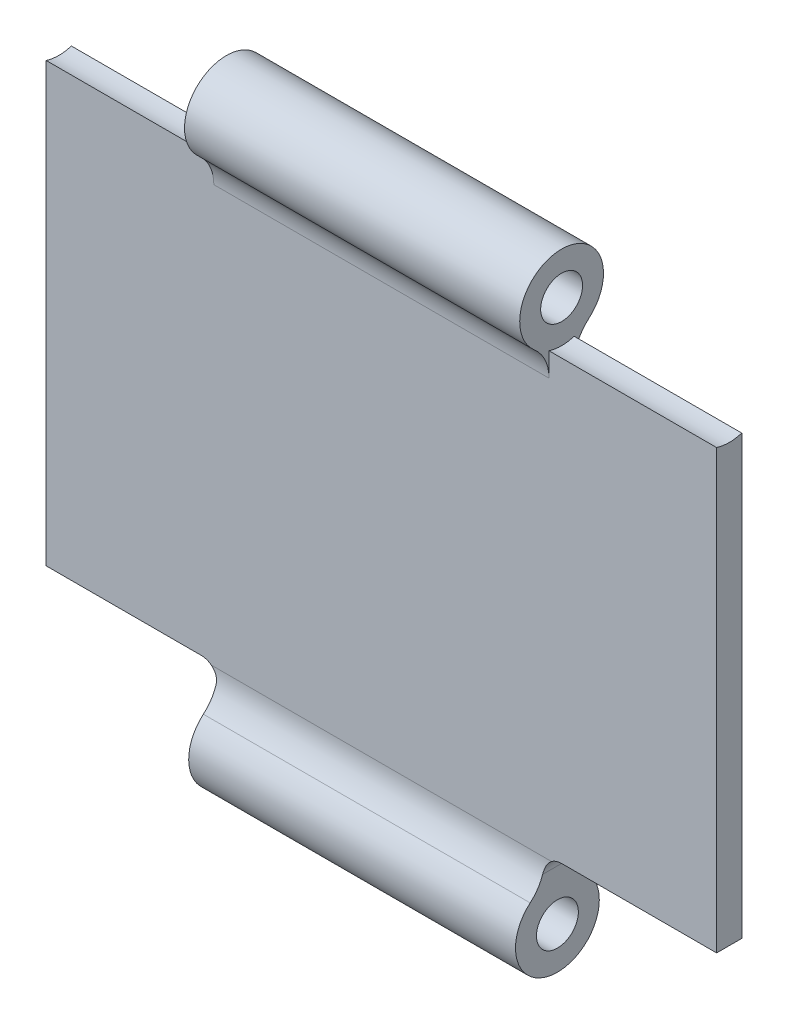
from build123d import *

# Parameters (mm, degrees)
SKETCH_1_W                  = 80
SKETCH_1_H                  = 65
EXTRUDE_1_DEPTH             = 3
CUT_EXTRUDE_1_DEPTH         = 52.626059311
CUT_EXTRUDE_1_DEPTH_BACK    = 3
EXTRUDE_2_REACH             = 53.626
SKETCH_4_R                  = 5
EXTRUDE_2_DIRECTION_2_REACH = 53.626
SKETCH_6_R                  = 2.5
CUT_EXTRUDE_3_DEPTH         = 71.631083809
FILLET_1_R                  = 5
SKETCH_8_R                  = 5
EXTRUDE_3_DEPTH             = 20
SKETCH_9_R                  = 5
CUT_EXTRUDE_4_DEPTH         = 72.052797271
FILLET_2_R                  = 5
SKETCH_10_R                 = 2.5
CUT_EXTRUDE_5_DEPTH         = 72.052797271
FILLET_3_R                  = 2


with BuildPart() as part:
    # 草图1 → 凸台-拉伸1 (new body)
    with BuildSketch(Plane.XY):
        Rectangle(SKETCH_1_W, SKETCH_1_H)
    extrude(amount=EXTRUDE_1_DEPTH)

    # 草图3 → 切除-拉伸1 (cut, two sides: drawn at the far end of the back side and taken through both)
    with BuildSketch(Plane.XY.offset(3).offset(-CUT_EXTRUDE_1_DEPTH_BACK)):
        Polygon((-246.458647048, -24.5), (-40, -24.5), (-19.5, -24.5), (-19.5, -32.5), (19.5, -32.5), (19.5, -24.5), (40, -24.5), (246.458647048, -24.5), (246.458647048, -437.417294096), (-246.458647048, -437.417294096), align=None)
    extrude(amount=CUT_EXTRUDE_1_DEPTH + CUT_EXTRUDE_1_DEPTH_BACK, mode=Mode.SUBTRACT)

    # 凸台-拉伸2: up to this face of the body (flat: up to its plane)
    extrude_2_end = Plane(part.part.faces().sort_by_distance((19.5, -28.5, 1.5))[0])
    # 草图4 → 凸台-拉伸2 (add, up to the picked face)
    with BuildSketch(Plane(origin=(0, 0, 0), x_dir=(0, 0, -1), z_dir=(1, 0, 0)), mode=Mode.PRIVATE) as extrude_2_sk1:
        with Locations((-1.5, -32.5)):
            Circle(SKETCH_4_R)
    extrude_2_tool1 = split(extrude(extrude_2_sk1.sketch, amount=EXTRUDE_2_REACH, mode=Mode.PRIVATE), bisect_by=extrude_2_end, keep=Keep.BOTH, mode=Mode.PRIVATE)
    add(extrude_2_tool1.solids().sort_by(Axis((0, -32.5, 1.5), (1, 0, 0)))[0])

    # 凸台-拉伸2 direction 2: up to this face of the body (flat: up to its plane)
    extrude_2_direction_2_end = Plane(part.part.faces().sort_by_distance((-19.5, -28.5, 1.5))[0])
    # 草图4 → 凸台-拉伸2 direction 2 (add, up to the picked face)
    with BuildSketch(Plane(origin=(0, 0, 0), x_dir=(0, 0, -1), z_dir=(1, 0, 0)), mode=Mode.PRIVATE) as extrude_2_direction_2_sk1:
        with Locations((-1.5, -32.5)):
            Circle(SKETCH_4_R)
    extrude_2_direction_2_tool1 = split(extrude(extrude_2_direction_2_sk1.sketch, amount=-EXTRUDE_2_DIRECTION_2_REACH, mode=Mode.PRIVATE), bisect_by=extrude_2_direction_2_end, keep=Keep.BOTH, mode=Mode.PRIVATE)
    add(extrude_2_direction_2_tool1.solids().sort_by(Axis((0, -32.5, 1.5), (-1, 0, 0)))[0])

    # 草图6 → 切除-拉伸3 (cut, through all)
    with BuildSketch(Plane.ZY.offset(19.5)):
        with Locations((1.5, -32.5)):
            Circle(SKETCH_6_R)
    extrude(amount=-CUT_EXTRUDE_3_DEPTH, mode=Mode.SUBTRACT)

    # 圆角1
    fillet_1_edges = [part.edges().sort_by_distance(p)[0] for p in [
        (0, -27.730303993, 0),
        (0, -27.730303993, 3),
    ]]
    fillet(fillet_1_edges, radius=FILLET_1_R)

    # 草图8 → 凸台-拉伸3 (add, symmetric)
    with BuildSketch(Plane(origin=(0, 0, 0), x_dir=(0, 0, -1), z_dir=(1, 0, 0))):
        with Locations((-1.5, 32.5)):
            Circle(SKETCH_8_R)
    extrude(amount=EXTRUDE_3_DEPTH, both=True)

    # 草图9 → 切除-拉伸4 (cut, through all)
    with BuildSketch(Plane(origin=(20, 0, 0), x_dir=(0, 0, -1), z_dir=(1, 0, 0))):
        with Locations((-1.5, 32.5)):
            Circle(SKETCH_9_R)
    cut_extrude_4 = extrude(amount=CUT_EXTRUDE_4_DEPTH, mode=Mode.SUBTRACT)

    # 镜向1: 切除-拉伸4 across plane
    add(cut_extrude_4.mirror(Plane(origin=(0, 0, 0), x_dir=(0, 0, 1), z_dir=(1, 0, 0))), mode=Mode.SUBTRACT)

    # 圆角2
    fillet_2_edges = [part.edges().sort_by_distance(p)[0] for p in [
        (0, 27.730303993, 3),
        (0, 27.730303993, 0),
    ]]
    fillet(fillet_2_edges, radius=FILLET_2_R)

    # 草图10 → 切除-拉伸5 (cut, through all)
    with BuildSketch(Plane(origin=(20, 0, 0), x_dir=(0, 0, -1), z_dir=(1, 0, 0))):
        with Locations((-1.5, 32.5)):
            Circle(SKETCH_10_R)
    extrude(amount=-CUT_EXTRUDE_5_DEPTH, mode=Mode.SUBTRACT)

    # 圆角3
    fillet_3_edges = [part.edges().sort_by_distance(p)[0] for p in [
        (-19.5, -24.5, 1.5),
    ]]
    fillet(fillet_3_edges, radius=FILLET_3_R)
    fillet_3_2_edges = [part.edges().sort_by_distance(p)[0] for p in [
        (19.5, -24.5, 1.5),
    ]]
    fillet(fillet_3_2_edges, radius=FILLET_3_R)


solid = part.part
